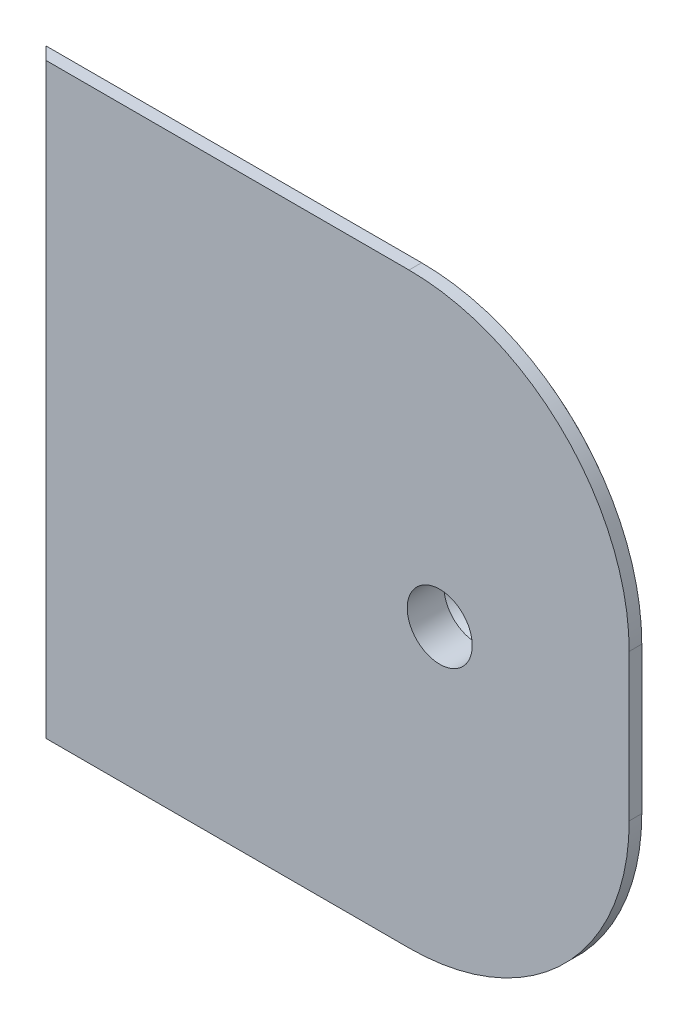
from build123d import *

# Parameters (mm, degrees)
SKETCH_2_R            = 2.6
EXTRUDE_1_DEPTH       = 1.2
EXTRUDE_1_2_DEPTH     = 2
CUT_EXTRUDE_START     = -2
CUT_EXTRUDE_1_DEPTH   = 2
SKETCH_7_W            = 2
SKETCH_7_H            = 51.2
EXTRUDE_2_DEPTH       = 0.4
SKETCH_8_W            = 2.4
SKETCH_8_H            = 47.2
CUT_EXTRUDE_1_2_DEPTH = 2
CUT_EXTRUDE_2_DEPTH   = 62
SKETCH_10_W           = 2
SKETCH_10_H           = 2
CUT_EXTRUDE_3_DEPTH   = 0.2
SKETCH_11_W           = 14.43
SKETCH_11_H           = 14
SKETCH_11_R           = 2.6
EXTRUDE_3_DEPTH       = 5.4
SKETCH_12_R           = 3
SKETCH_12_R_2         = 2
EXTRUDE_2_2_DEPTH     = 2
SKETCH_13_R           = 3.1
CUT_EXTRUDE_4_DEPTH   = 4.6
CHAMFER_1_SIZE        = 1.1
SKETCH_14_R           = 11
SKETCH_14_R_2         = 6
CUT_EXTRUDE_2_2_DEPTH = 5.4


with BuildPart() as part:
    # Эскиз2 → Extrude 1 (new body)
    with BuildSketch(Plane.XY):
        with BuildLine():
            Line((68.5, -7), (68.5, 7))
            ThreePointArc((68.5, 7), (62.349242405, 21.849242405), (47.5, 28))
            Line((47.5, 28), (11.5, 28))
            Line((11.5, 28), (11.5, -28))
            Line((11.5, -28), (47.5, -28))
            ThreePointArc((47.5, -28), (62.349242405, -21.849242405), (68.5, -7))
        make_face()
        with Locations((50.43, 0)):
            Circle(SKETCH_2_R, mode=Mode.SUBTRACT)
    extrude(amount=-EXTRUDE_1_DEPTH)

    # Эскиз3 → Extrude 1 2 (add)
    with BuildSketch(Plane(origin=(0, 0, -1.2), x_dir=(-1, 0, 0), z_dir=(0, 0, -1))):
        with BuildLine():
            Line((-46.5, -26), (-11.5, -26))
            Line((-11.5, -26), (-11.5, 26))
            Line((-11.5, 26), (-46.5, 26))
            ThreePointArc((-46.5, 26), (-60.642135624, 20.142135624), (-66.5, 6))
            Line((-66.5, 6), (-66.5, -6))
            ThreePointArc((-66.5, -6), (-60.642135624, -20.142135624), (-46.5, -26))
        make_face()
        with BuildLine():
            Line((-46.5, -23.6), (-13.9, -23.6))
            Line((-13.9, -23.6), (-13.9, 23.6))
            Line((-13.9, 23.6), (-46.5, 23.6))
            ThreePointArc((-46.5, 23.6), (-58.945079349, 18.445079349), (-64.1, 6))
            Line((-64.1, 6), (-64.1, -6))
            ThreePointArc((-64.1, -6), (-58.945079349, -18.445079349), (-46.5, -23.6))
        make_face(mode=Mode.SUBTRACT)
    extrude(amount=EXTRUDE_1_2_DEPTH)

    # Эскиз4 → Cut-Extrude 1 (cut)
    with BuildSketch(Plane(origin=(0, 0, -3.2), x_dir=(-1, 0, 0), z_dir=(0, 0, -1)).offset(CUT_EXTRUDE_START)):
        with BuildLine():
            Line((-66.5, 6), (-66.5, -6))
            ThreePointArc((-66.5, -6), (-60.642135624, -20.142135624), (-46.5, -26))
            Line((-46.5, -26), (-11.5, -26))
            Line((-11.5, -26), (-11.5, 26))
            Line((-11.5, 26), (-46.5, 26))
            ThreePointArc((-46.5, 26), (-60.642135624, 20.142135624), (-66.5, 6))
        make_face()
        with BuildLine():
            Line((-66.1, 6), (-66.1, -6))
            ThreePointArc((-66.1, -6), (-60.359292911, -19.859292911), (-46.5, -25.6))
            Line((-46.5, -25.6), (-11.9, -25.6))
            Line((-11.9, -25.6), (-11.9, 25.6))
            Line((-11.9, 25.6), (-46.5, 25.6))
            ThreePointArc((-46.5, 25.6), (-60.359292911, 19.859292911), (-66.1, 6))
        make_face(mode=Mode.SUBTRACT)
    extrude(amount=CUT_EXTRUDE_1_DEPTH, mode=Mode.SUBTRACT)

    # Эскиз7 → Extrude 2 (add)
    with BuildSketch(Plane.ZY.offset(-11.9)):
        with Locations((-2.2, 0)):
            Rectangle(SKETCH_7_W, SKETCH_7_H)
    extrude(amount=EXTRUDE_2_DEPTH)

    # Эскиз8 → Cut-Extrude 1 2 (cut)
    with BuildSketch(Plane(origin=(0, 0, -3.2), x_dir=(-1, 0, 0), z_dir=(0, 0, -1))):
        with Locations((-12.7, 0)):
            Rectangle(SKETCH_8_W, SKETCH_8_H)
    extrude(amount=-CUT_EXTRUDE_1_2_DEPTH, mode=Mode.SUBTRACT)

    # Эскиз9 → Cut-Extrude 2 (cut)
    with BuildSketch(Plane(origin=(0, 28, 0), x_dir=(1, 0, 0), z_dir=(0, 1, 0))):
        Polygon((11.5, 0), (12.9, 0), (11.7, 1.2), (11.5, 1.2), align=None)
    extrude(amount=-CUT_EXTRUDE_2_DEPTH, mode=Mode.SUBTRACT)

    # Эскиз10 → Вырез-Вытянуть3 (cut)
    with BuildSketch(Plane.ZY.offset(-11.5)):
        with Locations((-2.2, 24.6)):
            Rectangle(SKETCH_10_W, SKETCH_10_H)
        with Locations((-2.2, -24.6)):
            Rectangle(SKETCH_10_W, SKETCH_10_H)
    extrude(amount=-CUT_EXTRUDE_3_DEPTH, mode=Mode.SUBTRACT)

    # Эскиз11 → Бобышка-Вытянуть3 (add)
    with BuildSketch(Plane(origin=(0, 0, -1.2), x_dir=(-1, 0, 0), z_dir=(0, 0, -1))):
        with Locations((-50.215, 0)):
            Rectangle(SKETCH_11_W, SKETCH_11_H)
        with Locations(Location((-50.43, 0, 0), (0, 0, 180))):
            Circle(SKETCH_11_R, mode=Mode.SUBTRACT)
    extrude(amount=EXTRUDE_3_DEPTH)

    # Эскиз12 → Extrude 2 2 (add)
    with BuildSketch(Plane(origin=(0, 0, -6.6), x_dir=(-1, 0, 0), z_dir=(0, 0, -1))):
        with Locations((-50.43, 0)):
            Circle(SKETCH_12_R)
        with Locations((-50.43, 0)):
            Circle(SKETCH_12_R_2, mode=Mode.SUBTRACT)
    extrude(amount=-EXTRUDE_2_2_DEPTH)

    # Эскиз13 → Вырез-Вытянуть4 (cut)
    with BuildSketch(Plane.XY):
        with Locations((50.43, 0)):
            Circle(SKETCH_13_R)
    extrude(amount=-CUT_EXTRUDE_4_DEPTH, mode=Mode.SUBTRACT)

    # Фаска1
    chamfer_1_edges = [part.edges().sort_by_distance(p)[0] for p in [
        (47.33, 0, -4.6),
    ]]
    chamfer(chamfer_1_edges, length=CHAMFER_1_SIZE - 0.0001)  # a hair under: the kernel refuses the full size

    # Эскиз14 → Cut-Extrude 2 2 (cut)
    with BuildSketch(Plane(origin=(0, 0, -6.6), x_dir=(-1, 0, 0), z_dir=(0, 0, -1))):
        with Locations((-50.43, 0)):
            Circle(SKETCH_14_R)
        with Locations((-50.43, 0)):
            Circle(SKETCH_14_R_2, mode=Mode.SUBTRACT)
    extrude(amount=-CUT_EXTRUDE_2_2_DEPTH, mode=Mode.SUBTRACT)


solid = part.part
